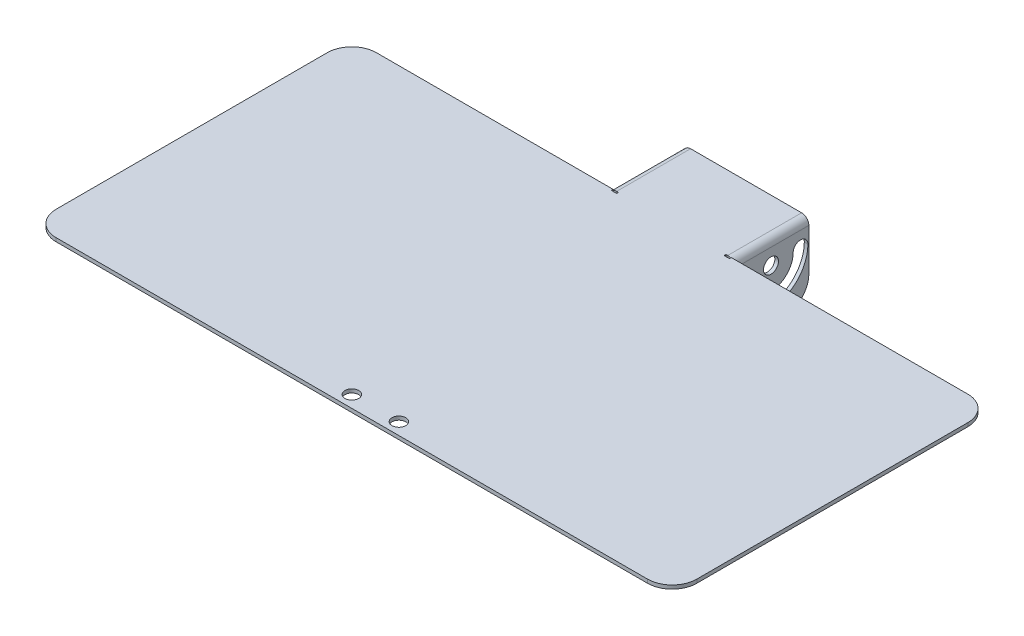
from build123d import *

# Parameters (mm, degrees)
BASE_FLANGE1_DEPTH   = 0.7366
FILLET1_R            = 5
FILLET2_R            = 5
FILLET3_R            = 5
FILLET4_R            = 5
EDGE_FLANGE2_START   = -47.5
EDGE_FLANGE2_DEPTH   = 15.3683
EDGE_FLANGE2_START_2 = -32.5
EDGE_FLANGE2_2_DEPTH = 0.3683
EDGE_FLANGE2_3_DEPTH = 15
FILLET7_R            = 5
FILLET8_R            = 5
SKETCH18_R           = 1.5
CUT_EXTRUDE1_DEPTH   = 40
SKETCH23_R           = 1.52
CUT_EXTRUDE6_DEPTH   = 30
SKETCH24_R           = 1.52
CUT_EXTRUDE7_DEPTH   = 30
SKETCH25_R           = 1.4
CUT_EXTRUDE8_DEPTH   = 10


with BuildPart() as part:
    # Base-Flange1: sheet metal written as solids
    # Sketch1 → Base-Flange1 (new body)
    with BuildSketch(Plane(origin=(0, 0, 0), x_dir=(1, 0, 0), z_dir=(0, 1, 0))):
        Polygon((19.610938441, 32.5), (65, 32.5), (65, -32.5), (-65, -32.5), (-65, 32.5), (-19.610938441, 32.5), (-11.999061559, 32.5), (-11.999061559, 47.5), (12.000938441, 47.5), (12.000938441, 32.5), align=None)
    extrude(amount=-BASE_FLANGE1_DEPTH)

    # Fillet1
    fillet1_edges = [part.edges().sort_by_distance(p)[0] for p in [
        (65, -0.3683, 32.5),
    ]]
    fillet(fillet1_edges, radius=FILLET1_R)

    # Fillet2
    fillet2_edges = [part.edges().sort_by_distance(p)[0] for p in [
        (65, -0.3683, -32.5),
    ]]
    fillet(fillet2_edges, radius=FILLET2_R)

    # Fillet3
    fillet3_edges = [part.edges().sort_by_distance(p)[0] for p in [
        (-65, -0.3683, 32.5),
    ]]
    fillet(fillet3_edges, radius=FILLET3_R)

    # Fillet4
    fillet4_edges = [part.edges().sort_by_distance(p)[0] for p in [
        (-65, -0.3683, -32.5),
    ]]
    fillet(fillet4_edges, radius=FILLET4_R)

    # Edge-Flange2: read off the stored shape, not the designer's step
    # Edge-Flange2 outline → Edge-Flange2 (cut)
    with BuildSketch(Plane.XY.offset(EDGE_FLANGE2_START)):
        with BuildLine():
            ThreePointArc((-11.999061559, -0.197371375), (-11.643753776, -0.050198073), (-11.262461559, 0))
            Line((-11.262461559, 0), (-11.999061559, 0))
            Line((-11.999061559, 0), (-11.999061559, -0.197371375))
        make_face()
        with BuildLine():
            ThreePointArc((11.264338441, 0), (11.645630659, -0.050198073), (12.000938441, -0.197371375))
            Line((12.000938441, -0.197371375), (12.000938441, 0))
            Line((12.000938441, 0), (11.264338441, 0))
        make_face()
    extrude(amount=EDGE_FLANGE2_DEPTH, mode=Mode.SUBTRACT)

    # Edge-Flange2 2 outline → Edge-Flange2 2 (cut)
    with BuildSketch(Plane.XY.offset(EDGE_FLANGE2_START_2)):
        with BuildLine():
            Line((-11.999061559, -0.7366), (-10.894161559, -0.7366))
            Line((-10.894161559, -0.7366), (-10.894161559, 0))
            Line((-10.894161559, 0), (-11.262461559, 0))
            ThreePointArc((-11.262461559, 0), (-11.643753776, -0.050198073), (-11.999061559, -0.197371375))
            Line((-11.999061559, -0.197371375), (-11.999061559, -0.7366))
        make_face()
        with BuildLine():
            Line((12.000938441, -0.7366), (12.000938441, -0.197371375))
            ThreePointArc((12.000938441, -0.197371375), (11.645630659, -0.050198073), (11.264338441, 0))
            Line((11.264338441, 0), (10.896038441, 0))
            Line((10.896038441, 0), (10.896038441, -0.7366))
            Line((10.896038441, -0.7366), (12.000938441, -0.7366))
        make_face()
    extrude(amount=EDGE_FLANGE2_2_DEPTH, mode=Mode.SUBTRACT)

    # Edge-Flange2 3 outline → Edge-Flange2 3 (add)
    with BuildSketch(Plane.XY.offset(EDGE_FLANGE2_START)):
        with BuildLine():
            ThreePointArc((-11.999061559, -1.4732), (-11.783316414, -0.952345145), (-11.262461559, -0.7366))
            Line((-11.262461559, -0.7366), (-11.999061559, -0.7366))
            Line((-11.999061559, -0.7366), (-11.999061559, -0.197371375))
            ThreePointArc((-11.999061559, -0.197371375), (-12.538290183, -0.7366), (-12.735661559, -1.4732))
            Line((-12.735661559, -1.4732), (-12.735661559, -15))
            Line((-12.735661559, -15), (-11.999061559, -15))
            Line((-11.999061559, -15), (-11.999061559, -1.4732))
        make_face()
        with BuildLine():
            Line((12.737538441, -15), (12.737538441, -1.4732))
            ThreePointArc((12.737538441, -1.4732), (12.540167066, -0.7366), (12.000938441, -0.197371375))
            Line((12.000938441, -0.197371375), (12.000938441, -0.7366))
            Line((12.000938441, -0.7366), (11.264338441, -0.7366))
            ThreePointArc((11.264338441, -0.7366), (11.785193296, -0.952345145), (12.000938441, -1.4732))
            Line((12.000938441, -1.4732), (12.000938441, -15))
            Line((12.000938441, -15), (12.737538441, -15))
        make_face()
    extrude(amount=EDGE_FLANGE2_3_DEPTH)

    # Fillet7
    fillet7_edges = [part.edges().sort_by_distance(p)[0] for p in [
        (12.369238441, -15, -47.5),
    ]]
    fillet(fillet7_edges, radius=FILLET7_R)

    # Fillet8
    fillet8_edges = [part.edges().sort_by_distance(p)[0] for p in [
        (-12.367361559, -15, -47.5),
    ]]
    fillet(fillet8_edges, radius=FILLET8_R)

    # Sketch18 → Cut-Extrude1 (cut)
    with BuildSketch(Plane.ZY.offset(12.735661559)):
        with Locations(Location((-39.810498868, -4.68598948, 0), (0, 0, 270))):
            Circle(SKETCH18_R)
        with BuildLine():
            ThreePointArc((-39.496869826, -12.179429066), (-38.060907717, -10.61801534), (-39.622321443, -9.182053232))
            ThreePointArc((-39.622321443, -9.182053232), (-42.925238149, -7.933819403), (-44.310498868, -4.68598948))
            ThreePointArc((-44.310498868, -4.68598948), (-45.810498868, -3.18598948), (-47.310498868, -4.68598948))
            ThreePointArc((-47.310498868, -4.68598948), (-45.001731004, -10.099039351), (-39.496869826, -12.179429066))
        make_face()
    extrude(amount=-CUT_EXTRUDE1_DEPTH, mode=Mode.SUBTRACT)

    # Sketch23 → Cut-Extrude6 (cut)
    with BuildSketch(Plane(origin=(13.900294902, -97.850887802, -222.979867512), x_dir=(-3.678229639825758e-15, -0.0327435829113364, -0.9994637851258686), z_dir=(1, 0, 0))):
        with Locations(Location((-186.121703077, 87.117320509, 0), (0, 0, 271.876404504))):
            Circle(SKETCH23_R)
    extrude(amount=-CUT_EXTRUDE6_DEPTH, mode=Mode.SUBTRACT)

    # Sketch24 → Cut-Extrude7 (cut)
    with BuildSketch(Plane(origin=(13.900294902, -97.850887802, -222.979867512), x_dir=(-3.678229639825758e-15, -0.0327435829113364, -0.9994637851258686), z_dir=(1, 0, 0))):
        with Locations((-187.007062576, 81.183001798)):
            Circle(SKETCH24_R)
    extrude(amount=-CUT_EXTRUDE7_DEPTH, mode=Mode.SUBTRACT)

    # Sketch25 → Cut-Extrude8 (cut)
    with BuildSketch(Plane(origin=(-71.983966672, 0, -96.098250098), x_dir=(1, 0, 0), z_dir=(0, 1, 0))):
        with Locations(Location((79.090906604, -126.157708005, 0), (0, 0, 270))):
            Circle(SKETCH25_R)
        with Locations(Location((69.540906604, -126.157708005, 0), (0, 0, 270))):
            Circle(SKETCH25_R)
    extrude(amount=-CUT_EXTRUDE8_DEPTH, mode=Mode.SUBTRACT)


solid = part.part
